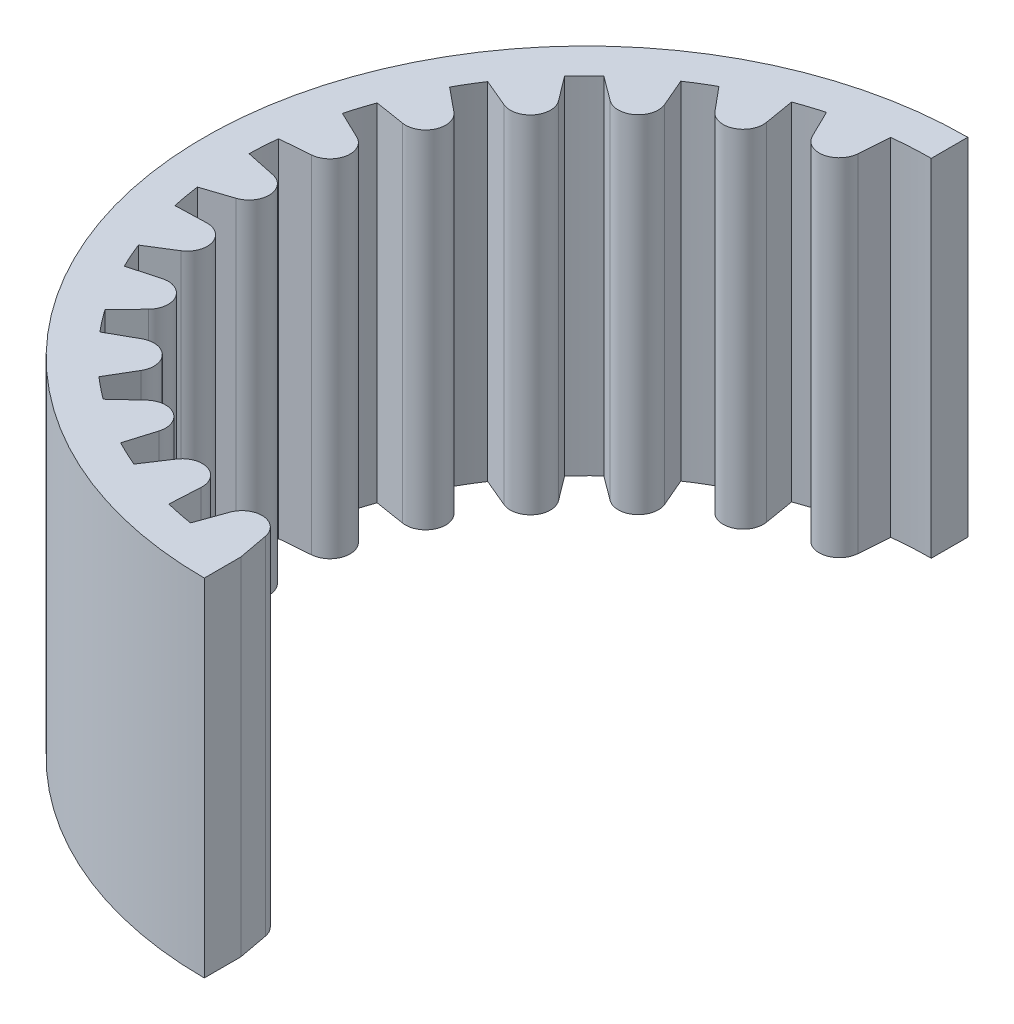
from build123d import *

# Parameters (mm, degrees)
BOSS_EXTRUDE1_DEPTH = 3.0099
BOSS_EXTRUDE2_DEPTH = 6.0198
CRVPATTERN1_START   = -3.0099
CRVPATTERN1_DEPTH   = 6.0198


# Read off the part's stored shape, not the designer's step: CrvPattern1
with BuildPart() as part:
    # Sketch1 → Boss-Extrude1 (new, symmetric)
    with BuildSketch(Plane(origin=(0, 0, 0), x_dir=(1, 0, 0), z_dir=(0, 1, 0))):
        with BuildLine():
            Line((0, -6), (0, -6.635))
            ThreePointArc((0, -6.635), (-6.635, 0), (0, 6.635))
            Line((0, 6.635), (0, 6))
            ThreePointArc((0, 6), (-6, 0), (0, -6))
        make_face()
    extrude(amount=BOSS_EXTRUDE1_DEPTH, both=True)

    # Sketch2 → Boss-Extrude2 (add)
    with BuildSketch(Plane(origin=(0, 3.0099, 0), x_dir=(1, 0, 0), z_dir=(0, 1, 0))):
        with BuildLine():
            Line((0, -6), (-0.097943085, -5.475567721))
            ThreePointArc((-0.097943085, -5.475567721), (-0.413392769, -5.191665428), (-0.769794827, -5.422070697))
            Line((-0.769794827, -5.422070697), (-0.949494698, -5.924395312))
            ThreePointArc((-0.949494698, -5.924395312), (-0.47625, -5.981068963), (0, -6))
        make_face()
    extrude(amount=-BOSS_EXTRUDE2_DEPTH)

    # CrvPattern1 outline → CrvPattern1 (add)
    with BuildSketch(Plane(origin=(0, 0, 0), x_dir=(1, 0, 0), z_dir=(0, 1, 0)).offset(CRVPATTERN1_START)):
        with BuildLine():
            ThreePointArc((-1.392781631, -5.296375557), (-1.631964533, -4.945803803), (-2.0328165, -5.085183555))
            Line((-2.0328165, -5.085183555), (-2.326440816, -5.530612365))
            ThreePointArc((-2.326440816, -5.530612365), (-1.880108137, -5.697823566), (-1.421911325, -5.829079531))
            Line((-1.421911325, -5.829079531), (-1.392781631, -5.296375557))
        make_face()
        with BuildLine():
            ThreePointArc((-0.667838723, 5.962716784), (-1.139022221, 5.890893683), (-1.603018095, 5.781897006))
            Line((-1.603018095, 5.781897006), (-1.368522884, 5.302695525))
            ThreePointArc((-1.368522884, 5.302695525), (-0.988689868, 5.113391814), (-0.706800505, 5.430641561))
            Line((-0.706800505, 5.430641561), (-0.667838723, 5.962716784))
        make_face()
        with BuildLine():
            ThreePointArc((-2.061889926, 5.634590485), (-2.502629927, 5.453149865), (-2.927577467, 5.237297984))
            Line((-2.927577467, 5.237297984), (-2.586198593, 4.827319293))
            ThreePointArc((-2.586198593, 4.827319293), (-2.172323601, 4.733423039), (-1.97364785, 5.108438987))
            Line((-1.97364785, 5.108438987), (-2.061889926, 5.634590485))
        make_face()
        with BuildLine():
            ThreePointArc((-3.338468064, 4.985441905), (-3.723654071, 4.704721071), (-4.085342534, 4.394311821))
            Line((-4.085342534, 4.394311821), (-3.656529542, 4.076913836))
            ThreePointArc((-3.656529542, 4.076913836), (-3.232192478, 4.083774637), (-3.128049589, 4.495190818))
            Line((-3.128049589, 4.495190818), (-3.338468064, 4.985441905))
        make_face()
        with BuildLine():
            ThreePointArc((-4.424842028, 4.052255302), (-4.732528651, 3.6882479), (-5.010351382, 3.300966378))
            Line((-5.010351382, 3.300966378), (-4.518535244, 3.09423237))
            ThreePointArc((-4.518535244, 3.09423237), (-4.10791207, 3.201459343), (-4.104235427, 3.625835941))
            Line((-4.104235427, 3.625835941), (-4.424842028, 4.052255302))
        make_face()
        with BuildLine():
            ThreePointArc((-5.2591173, 2.888197574), (-5.471774558, 2.461642376), (-5.649903027, 2.019553363))
            Line((-5.649903027, 2.019553363), (-5.123104226, 1.93526169))
            ThreePointArc((-5.123104226, 1.93526169), (-4.749589577, 2.136745739), (-4.846588652, 2.549904539))
            Line((-4.846588652, 2.549904539), (-5.2591173, 2.888197574))
        make_face()
        with BuildLine():
            ThreePointArc((-5.793762308, 1.559589152), (-5.899274375, 1.094788495), (-5.967559981, 0.623079345))
            Line((-5.967559981, 0.623079345), (-5.435792082, 0.666032397))
            ThreePointArc((-5.435792082, 0.666032397), (-5.120666391, 0.950294273), (-5.312814808, 1.328696177))
            Line((-5.312814808, 1.328696177), (-5.793762308, 1.559589152))
        make_face()
        with BuildLine():
            ThreePointArc((-5.998316459, 0.142125493), (-5.990671945, -0.334439306), (-5.945224219, -0.808893678))
            Line((-5.945224219, -0.808893678), (-5.438783895, -0.641143085))
            ThreePointArc((-5.438783895, -0.641143085), (-5.200000973, -0.290298773), (-5.476351366, 0.031787357))
            Line((-5.476351366, 0.031787357), (-5.998316459, 0.142125493))
        make_face()
        with BuildLine():
            ThreePointArc((-5.861125591, -1.28343555), (-5.740760029, -1.744612933), (-5.584168287, -2.194781205))
            Line((-5.584168287, -2.194781205), (-5.131909211, -1.911790408))
            ThreePointArc((-5.131909211, -1.911790408), (-4.983073354, -1.514352485), (-5.327881076, -1.266932499))
            Line((-5.327881076, -1.266932499), (-5.861125591, -1.28343555))
        make_face()
        with BuildLine():
            ThreePointArc((-5.390005944, -2.635874792), (-5.163776982, -3.055389873), (-4.904962802, -3.455624388))
            Line((-4.904962802, -3.455624388), (-4.532651751, -3.073516361))
            ThreePointArc((-4.532651751, -3.073516361), (-4.482242656, -2.652128252), (-4.875862809, -2.49347079))
            Line((-4.875862809, -2.49347079), (-5.390005944, -2.635874792))
        make_face()
        with BuildLine():
            ThreePointArc((-4.611798851, -3.838139049), (-4.292595541, -4.19209059), (-3.94630447, -4.519588591))
            Line((-3.94630447, -4.519588591), (-3.675153304, -4.060133361))
            ThreePointArc((-3.675153304, -4.060133361), (-3.726042954, -3.638803018), (-4.146049624, -3.577947349))
            Line((-4.146049624, -3.577947349), (-4.611798851, -3.838139049))
        make_face()
        with BuildLine():
            ThreePointArc((-3.570841484, -4.821731131), (-3.176849953, -5.089953278), (-2.762811401, -5.326056061))
            Line((-2.762811401, -5.326056061), (-2.608268548, -4.815430396))
            ThreePointArc((-2.608268548, -4.815430396), (-2.757557583, -4.418162477), (-3.180021524, -4.458575762))
            Line((-3.180021524, -4.458575762), (-3.570841484, -4.821731131))
        make_face()
    extrude(amount=CRVPATTERN1_DEPTH)


solid = part.part
